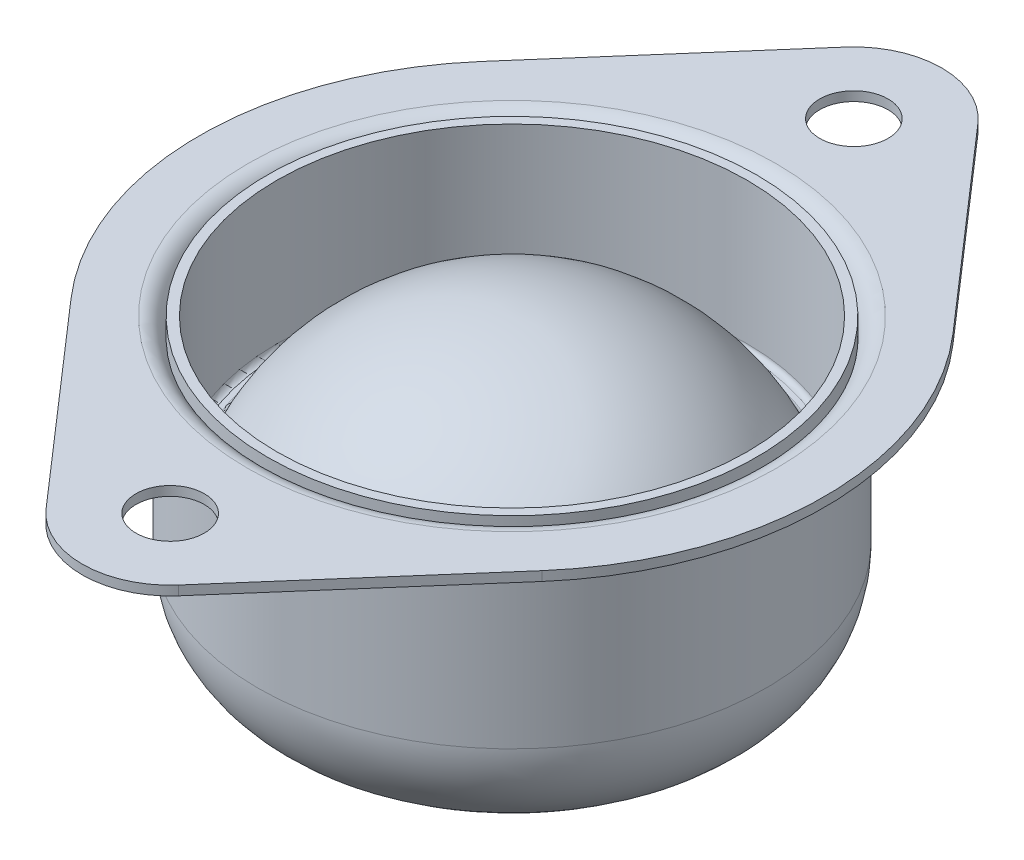
from build123d import *

# Parameters (mm, degrees)
SKETCH1_R           = 2.778125
BOSS_EXTRUDE1_DEPTH = 0.762
SKETCH2_R           = 20.6375
BOSS_EXTRUDE2_DEPTH = 23.84425
FILLET1_R           = 8.73125
FILLET2_R           = 1.5875
SKETCH6_R           = 11.90625
CUT_EXTRUDE3_DEPTH  = 0.762
SKETCH7_R           = 19.8755
BOSS_EXTRUDE3_DEPTH = 12.7
FILLET3_R           = 1.190625
SHELL2_T            = -0.762


# Read off the part's stored shape, not the designer's step: Shell1
with BuildPart() as part:
    # Sketch1 → Boss-Extrude1 (new body)
    with BuildSketch(Plane(origin=(0, 0, 0), x_dir=(1, 0, 0), z_dir=(0, 1, 0))):
        with BuildLine():
            Line((19.145657791, -16.691428571), (5.384716254, -32.475714286))
            ThreePointArc((5.384716254, -32.475714286), (0, -34.925), (-5.384716254, -32.475714286))
            Line((-5.384716254, -32.475714286), (-19.145657791, -16.691428571))
            ThreePointArc((-19.145657791, -16.691428571), (-25.4, 0), (-19.145657791, 16.691428571))
            Line((-19.145657791, 16.691428571), (-5.384716254, 32.475714286))
            ThreePointArc((-5.384716254, 32.475714286), (0, 34.925), (5.384716254, 32.475714286))
            Line((5.384716254, 32.475714286), (19.145657791, 16.691428571))
            ThreePointArc((19.145657791, 16.691428571), (25.4, 0), (19.145657791, -16.691428571))
        make_face()
        with Locations(Location((0, 27.78125, 0), (0, 0, 90))):
            Circle(SKETCH1_R, mode=Mode.SUBTRACT)
        with Locations(Location((0, -27.78125, 0), (0, 0, 90))):
            Circle(SKETCH1_R, mode=Mode.SUBTRACT)
    extrude(amount=BOSS_EXTRUDE1_DEPTH)

    # Sketch2 → Boss-Extrude2 (add)
    with BuildSketch(Plane.XZ):
        with Locations(Location((0, 0, 0), (0, 0, 90))):
            Circle(SKETCH2_R)
    extrude(amount=BOSS_EXTRUDE2_DEPTH)

    # Fillet1
    fillet1_edges = [part.edges().sort_by_distance(p)[0] for p in [
        (0, -23.84425, -20.6375),
    ]]
    fillet(fillet1_edges, radius=FILLET1_R)

    # Shell1 outline → Shell1 (revolve, cut)
    with BuildSketch(Plane.XY):
        with BuildLine():
            ThreePointArc((11.90625, -23.08225), (17.541360716, -20.748110716), (19.8755, -15.113))
            Line((19.8755, -15.113), (19.8755, 0.762))
            Line((19.8755, 0.762), (0, 0.762))
            Line((0, 0.762), (0, -23.08225))
            Line((0, -23.08225), (11.90625, -23.08225))
        make_face()
    revolve(axis=Axis((0, 0, 0), (0, 1, 0)), mode=Mode.SUBTRACT)

    # Fillet2
    fillet2_edges = [part.edges().sort_by_distance(p)[0] for p in [
        (0, 0, -20.6375),
        (-19.8755, 0.762, 0),
    ]]
    fillet(fillet2_edges, radius=FILLET2_R)

    # Sketch6 → Cut-Extrude3 (cut)
    with BuildSketch(Plane.XZ.offset(23.84425)):
        with Locations(Location((0, 0, 0), (0, 0, 90))):
            Circle(SKETCH6_R)
    extrude(amount=-CUT_EXTRUDE3_DEPTH, mode=Mode.SUBTRACT)


with BuildPart() as body_2:
    # Sketch7 → Boss-Extrude3 (new body)
    with BuildSketch(Plane(origin=(0, 0.762, 0), x_dir=(1, 0, 0), z_dir=(0, 1, 0))):
        with Locations(Location((0, 0, 0), (0, 0, 270))):
            Circle(SKETCH7_R)
    extrude(amount=-BOSS_EXTRUDE3_DEPTH)

    # Sketch8 → Cut-Revolve1 (revolve, cut)
    with BuildSketch(Plane(origin=(0, 0, 0), x_dir=(0, 0, -1), z_dir=(1, 0, 0))):
        with BuildLine():
            Line((0, 0), (0, -11.938))
            Line((0, -11.938), (-17.4625, -11.938))
            ThreePointArc((-17.4625, -11.938), (-10.576563126, -3.269738778), (0, 0))
        make_face()
    revolve(axis=Axis((0, -0.0381, 0), (0, 1, 0)), mode=Mode.SUBTRACT)

    # Fillet3
    fillet3_edges = [body_2.edges().sort_by_distance(p)[0] for p in [
        (0, -11.938, -19.8755),
        (0, -11.938, -17.4625),
    ]]
    fillet(fillet3_edges, radius=FILLET3_R)

    # Shell2
    shell2_openings = [body_2.faces().sort_by_distance(p)[0] for p in [
        (0, 0.762, 0),
    ]]
    offset(amount=SHELL2_T, openings=shell2_openings, kind=Kind.INTERSECTION)


with BuildPart() as body_3:
    # Sketch3 → Revolve1 (revolve)
    with BuildSketch(Plane(origin=(0, 0, 0), x_dir=(0, 0, -1), z_dir=(1, 0, 0))):
        with BuildLine():
            Line((0, -29.4005), (0, -4.0005))
            ThreePointArc((0, -4.0005), (-12.7, -16.7005), (0, -29.4005))
        make_face()
    revolve(axis=Axis((0, -106.822164787, 0), (0, 1, 0)))


solid = Compound([part.part, body_2.part, body_3.part])
